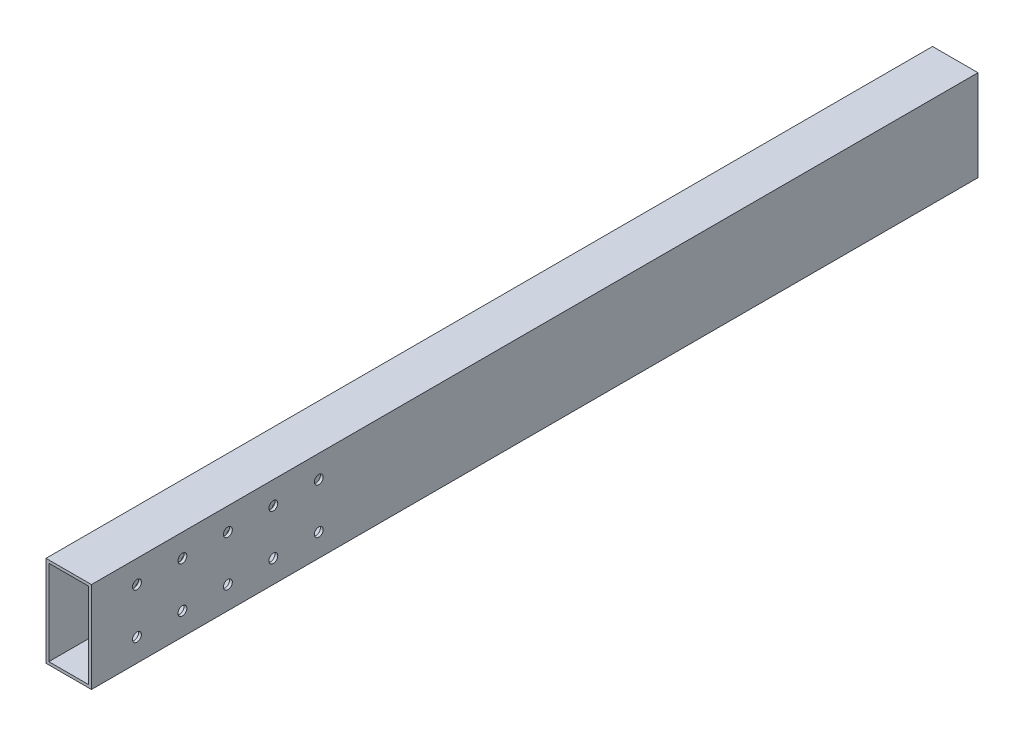
from build123d import *

# Parameters (mm, degrees)
SKETCH1_W           = 25.4
SKETCH1_H           = 50.8
SKETCH1_W_2         = 22.225
SKETCH1_H_2         = 47.625
BOSS_EXTRUDE1_DEPTH = 495.3
CUT_EXTRUDE1_REACH  = 500.546
SKETCH2_R           = 2.4892
CUT_EXTRUDE2_REACH  = 500.546
SKETCH3_R           = 14.2875
SKETCH3_R_2         = 2.4892
SKETCH2_3_R         = 2.4892
CUT_EXTRUDE5_DEPTH  = 499.54577523
CUT_EXTRUDE6_REACH  = 500.546
SKETCH4_R           = 2.4892


with BuildPart() as part:
    # Sketch1 → Boss-Extrude1 (new body)
    with BuildSketch(Plane.XY):
        with Locations((12.7, 25.4)):
            Rectangle(SKETCH1_W, SKETCH1_H)
        with Locations((12.7, 25.4)):
            Rectangle(SKETCH1_W_2, SKETCH1_H_2, mode=Mode.SUBTRACT)
    extrude(amount=BOSS_EXTRUDE1_DEPTH)

    # Sketch2 → Cut-Extrude1 (cut, up to next)
    with BuildSketch(Plane.ZY.offset(-25.4), mode=Mode.PRIVATE) as cut_extrude1_sk1:
        with Locations((393.7, 38.1)):
            Circle(SKETCH2_R)
    cut_extrude1_tool1 = extrude(cut_extrude1_sk1.sketch, amount=CUT_EXTRUDE1_REACH, mode=Mode.PRIVATE) & part.part
    # Sketch2 → Cut-Extrude1 (cut, up to next)
    with BuildSketch(Plane.ZY.offset(-25.4), mode=Mode.PRIVATE) as cut_extrude1_sk2:
        with Locations((368.3, 38.1)):
            Circle(SKETCH2_R)
    cut_extrude1_tool2 = extrude(cut_extrude1_sk2.sketch, amount=CUT_EXTRUDE1_REACH, mode=Mode.PRIVATE) & part.part
    # Sketch2 → Cut-Extrude1 (cut, up to next)
    with BuildSketch(Plane.ZY.offset(-25.4), mode=Mode.PRIVATE) as cut_extrude1_sk3:
        with Locations((393.7, 12.7)):
            Circle(SKETCH2_R)
    cut_extrude1_tool3 = extrude(cut_extrude1_sk3.sketch, amount=CUT_EXTRUDE1_REACH, mode=Mode.PRIVATE) & part.part
    # Sketch2 → Cut-Extrude1 (cut, up to next)
    with BuildSketch(Plane.ZY.offset(-25.4), mode=Mode.PRIVATE) as cut_extrude1_sk4:
        with Locations((368.3, 12.7)):
            Circle(SKETCH2_R)
    cut_extrude1_tool4 = extrude(cut_extrude1_sk4.sketch, amount=CUT_EXTRUDE1_REACH, mode=Mode.PRIVATE) & part.part
    add(cut_extrude1_tool1.solids().sort_by_distance((25.4, 38.1, 393.7))[0], mode=Mode.SUBTRACT)
    add(cut_extrude1_tool2.solids().sort_by_distance((25.4, 38.1, 368.3))[0], mode=Mode.SUBTRACT)
    add(cut_extrude1_tool3.solids().sort_by_distance((25.4, 12.7, 393.7))[0], mode=Mode.SUBTRACT)
    add(cut_extrude1_tool4.solids().sort_by_distance((25.4, 12.7, 368.3))[0], mode=Mode.SUBTRACT)

    # Sketch3 → Cut-Extrude2 (cut, up to next)
    with BuildSketch(Plane.ZY, mode=Mode.PRIVATE) as cut_extrude2_sk1:
        with Locations((114.3, 25.4)):
            Circle(SKETCH3_R)
    cut_extrude2_tool1 = extrude(cut_extrude2_sk1.sketch, amount=-CUT_EXTRUDE2_REACH, mode=Mode.PRIVATE) & part.part
    # Sketch3 → Cut-Extrude2 (cut, up to next)
    with BuildSketch(Plane.ZY, mode=Mode.PRIVATE) as cut_extrude2_sk2:
        with Locations((139.7, 41.275)):
            Circle(SKETCH3_R_2)
    cut_extrude2_tool2 = extrude(cut_extrude2_sk2.sketch, amount=-CUT_EXTRUDE2_REACH, mode=Mode.PRIVATE) & part.part
    # Sketch3 → Cut-Extrude2 (cut, up to next)
    with BuildSketch(Plane.ZY, mode=Mode.PRIVATE) as cut_extrude2_sk3:
        with Locations((88.9, 41.275)):
            Circle(SKETCH3_R_2)
    cut_extrude2_tool3 = extrude(cut_extrude2_sk3.sketch, amount=-CUT_EXTRUDE2_REACH, mode=Mode.PRIVATE) & part.part
    # Sketch3 → Cut-Extrude2 (cut, up to next)
    with BuildSketch(Plane.ZY, mode=Mode.PRIVATE) as cut_extrude2_sk4:
        with Locations((88.9, 9.525)):
            Circle(SKETCH3_R_2)
    cut_extrude2_tool4 = extrude(cut_extrude2_sk4.sketch, amount=-CUT_EXTRUDE2_REACH, mode=Mode.PRIVATE) & part.part
    # Sketch3 → Cut-Extrude2 (cut, up to next)
    with BuildSketch(Plane.ZY, mode=Mode.PRIVATE) as cut_extrude2_sk5:
        with Locations((139.7, 9.525)):
            Circle(SKETCH3_R_2)
    cut_extrude2_tool5 = extrude(cut_extrude2_sk5.sketch, amount=-CUT_EXTRUDE2_REACH, mode=Mode.PRIVATE) & part.part
    add(cut_extrude2_tool1.solids().sort_by_distance((0, 25.4, 114.3))[0], mode=Mode.SUBTRACT)
    add(cut_extrude2_tool2.solids().sort_by_distance((0, 41.275, 139.7))[0], mode=Mode.SUBTRACT)
    add(cut_extrude2_tool3.solids().sort_by_distance((0, 41.275, 88.9))[0], mode=Mode.SUBTRACT)
    add(cut_extrude2_tool4.solids().sort_by_distance((0, 9.525, 88.9))[0], mode=Mode.SUBTRACT)
    add(cut_extrude2_tool5.solids().sort_by_distance((0, 9.525, 139.7))[0], mode=Mode.SUBTRACT)

    # Sketch2<3> → Cut-Extrude5 (cut, through all)
    with BuildSketch(Plane.ZY.offset(-25.4)):
        with Locations((444.5, 38.1)):
            Circle(SKETCH2_3_R)
        with Locations((419.1, 38.1)):
            Circle(SKETCH2_3_R)
        with Locations((393.7, 38.1)):
            Circle(SKETCH2_3_R)
        with Locations((368.3, 38.1)):
            Circle(SKETCH2_3_R)
        with Locations((444.5, 12.7)):
            Circle(SKETCH2_3_R)
        with Locations((419.1, 12.7)):
            Circle(SKETCH2_3_R)
        with Locations((393.7, 12.7)):
            Circle(SKETCH2_3_R)
        with Locations((368.3, 12.7)):
            Circle(SKETCH2_3_R)
        with Locations((469.9, 12.7)):
            Circle(SKETCH2_3_R)
        with Locations((469.9, 38.1)):
            Circle(SKETCH2_3_R)
    extrude(amount=CUT_EXTRUDE5_DEPTH, mode=Mode.SUBTRACT)

    # Sketch4 → Cut-Extrude6 (cut, up to next)
    with BuildSketch(Plane.ZY, mode=Mode.PRIVATE) as cut_extrude6_sk1:
        with Locations((12.7, 38.1)):
            Circle(SKETCH4_R)
    cut_extrude6_tool1 = extrude(cut_extrude6_sk1.sketch, amount=-CUT_EXTRUDE6_REACH, mode=Mode.PRIVATE) & part.part
    # Sketch4 → Cut-Extrude6 (cut, up to next)
    with BuildSketch(Plane.ZY, mode=Mode.PRIVATE) as cut_extrude6_sk2:
        with Locations((25.4, 38.1)):
            Circle(SKETCH4_R)
    cut_extrude6_tool2 = extrude(cut_extrude6_sk2.sketch, amount=-CUT_EXTRUDE6_REACH, mode=Mode.PRIVATE) & part.part
    # Sketch4 → Cut-Extrude6 (cut, up to next)
    with BuildSketch(Plane.ZY, mode=Mode.PRIVATE) as cut_extrude6_sk3:
        with Locations((38.1, 38.1)):
            Circle(SKETCH4_R)
    cut_extrude6_tool3 = extrude(cut_extrude6_sk3.sketch, amount=-CUT_EXTRUDE6_REACH, mode=Mode.PRIVATE) & part.part
    # Sketch4 → Cut-Extrude6 (cut, up to next)
    with BuildSketch(Plane.ZY, mode=Mode.PRIVATE) as cut_extrude6_sk4:
        with Locations((25.4, 12.7)):
            Circle(SKETCH4_R)
    cut_extrude6_tool4 = extrude(cut_extrude6_sk4.sketch, amount=-CUT_EXTRUDE6_REACH, mode=Mode.PRIVATE) & part.part
    # Sketch4 → Cut-Extrude6 (cut, up to next)
    with BuildSketch(Plane.ZY, mode=Mode.PRIVATE) as cut_extrude6_sk5:
        with Locations((38.1, 12.7)):
            Circle(SKETCH4_R)
    cut_extrude6_tool5 = extrude(cut_extrude6_sk5.sketch, amount=-CUT_EXTRUDE6_REACH, mode=Mode.PRIVATE) & part.part
    # Sketch4 → Cut-Extrude6 (cut, up to next)
    with BuildSketch(Plane.ZY, mode=Mode.PRIVATE) as cut_extrude6_sk6:
        with Locations((12.7, 12.7)):
            Circle(SKETCH4_R)
    cut_extrude6_tool6 = extrude(cut_extrude6_sk6.sketch, amount=-CUT_EXTRUDE6_REACH, mode=Mode.PRIVATE) & part.part
    add(cut_extrude6_tool1.solids().sort_by_distance((0, 38.1, 12.7))[0], mode=Mode.SUBTRACT)
    add(cut_extrude6_tool2.solids().sort_by_distance((0, 38.1, 25.4))[0], mode=Mode.SUBTRACT)
    add(cut_extrude6_tool3.solids().sort_by_distance((0, 38.1, 38.1))[0], mode=Mode.SUBTRACT)
    add(cut_extrude6_tool4.solids().sort_by_distance((0, 12.7, 25.4))[0], mode=Mode.SUBTRACT)
    add(cut_extrude6_tool5.solids().sort_by_distance((0, 12.7, 38.1))[0], mode=Mode.SUBTRACT)
    add(cut_extrude6_tool6.solids().sort_by_distance((0, 12.7, 12.7))[0], mode=Mode.SUBTRACT)


solid = part.part
